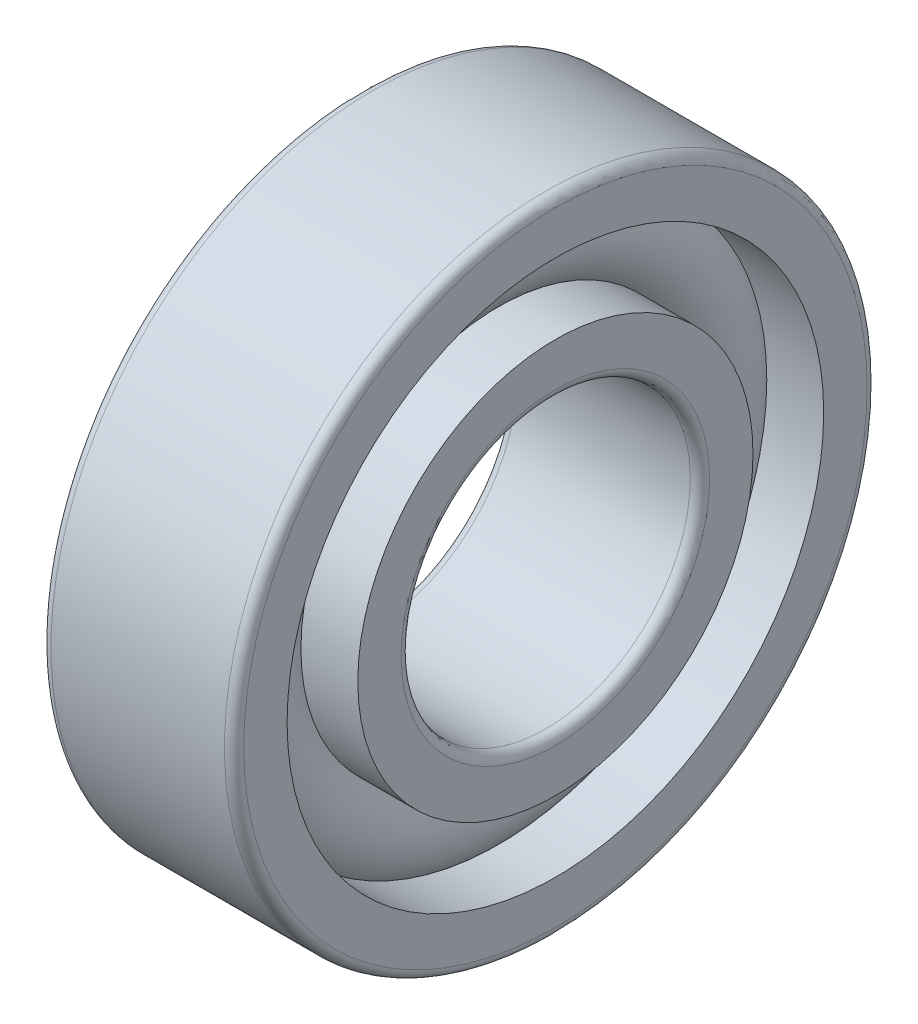
from build123d import *

# Parameters (mm, degrees)
CAGSPISKE_W     = 0.33
CAGSPISKE_H     = 0.55
CAGESPINE_ANGLE = 0.001
BALSIMSKE_R     = 1.65


with BuildPart() as part:
    # CagSpiSke → CageSpine (revolve)
    with BuildSketch(Plane.XY):
        with Locations((0, 7.25)):
            Rectangle(CAGSPISKE_W, CAGSPISKE_H)
    revolve(axis=Axis((-20.6375, 0, 0), (1, 0, 0)), revolution_arc=CAGESPINE_ANGLE)

    # BalSimSke → BallsSimplified (revolve)
    with BuildSketch(Plane.XY):
        with Locations((0, 7.25)):
            Circle(BALSIMSKE_R)
    revolve(axis=Axis((-10, 0, 0), (1, 0, 0)))

    # InnRacSke → InnerRace (revolve)
    with BuildSketch(Plane.XY):
        with BuildLine():
            Line((-1.196087371, 6.15), (-3, 6.15))
            Line((-3, 6.15), (-3, 4.8))
            ThreePointArc((-3, 4.8), (-2.912132034, 4.587867966), (-2.7, 4.5))
            Line((-2.7, 4.5), (2.7, 4.5))
            ThreePointArc((2.7, 4.5), (2.912132034, 4.587867966), (3, 4.8))
            Line((3, 4.8), (3, 6.15))
            Line((3, 6.15), (1.196087371, 6.15))
            ThreePointArc((1.196087371, 6.15), (0, 5.625), (-1.196087371, 6.15))
        make_face()
    revolve(axis=Axis((-20.6375, 0, 0), (1, 0, 0)))

    # OutRacSke → OuterRace (revolve)
    with BuildSketch(Plane.XY):
        with BuildLine():
            Line((-1.196087371, 8.35), (-3, 8.35))
            Line((-3, 8.35), (-3, 9.7))
            ThreePointArc((-3, 9.7), (-2.912132034, 9.912132034), (-2.7, 10))
            Line((-2.7, 10), (2.7, 10))
            ThreePointArc((2.7, 10), (2.912132034, 9.912132034), (3, 9.7))
            Line((3, 9.7), (3, 8.35))
            Line((3, 8.35), (1.196087371, 8.35))
            ThreePointArc((1.196087371, 8.35), (0, 8.875), (-1.196087371, 8.35))
        make_face()
    revolve(axis=Axis((-20.6375, 0, 0), (1, 0, 0)))


solid = part.part
